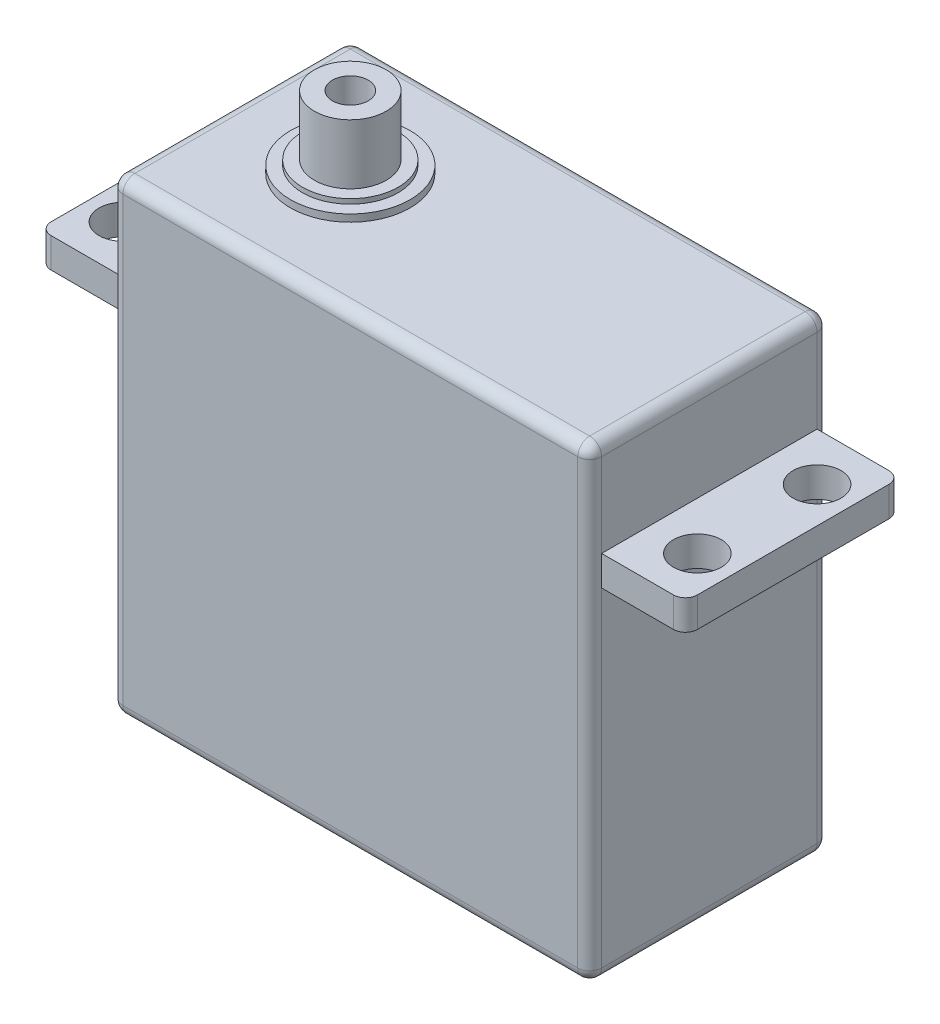
from build123d import *

# Parameters (mm, degrees)
SKETCH_2_W          = 40
SKETCH_2_H          = 39
EXTRUDE_1_DEPTH     = 20
FILLET_1_R          = 1
SKETCH_4_R          = 3
EXTRUDE_2_DEPTH     = 6
SKETCH_5_W          = 18
SKETCH_5_H          = 2.5
EXTRUDE_3_DEPTH     = 7
SKETCH_7_W          = 18
SKETCH_7_H          = 2.5
EXTRUDE_4_DEPTH     = 7
SKETCH_8_R          = 2
CUT_EXTRUDE_1_DEPTH = 7
FILLET_2_R          = 1
SKETCH_12_R         = 1.5
CUT_EXTRUDE_2_DEPTH = 7
SKETCH_13_R         = 4
EXTRUDE_5_DEPTH     = 1
SKETCH_14_R         = 5
EXTRUDE_6_DEPTH     = 0.6
CUT_EXTRUDE_3_REACH = 66.23
SKETCH_15_R         = 1.5


with BuildPart() as part:
    # 草图2 → 凸台-拉伸1 (new body)
    with BuildSketch(Plane.XY):
        with Locations((-19.102827215, 35.538568444)):
            Rectangle(SKETCH_2_W, SKETCH_2_H)
    extrude(amount=EXTRUDE_1_DEPTH)

    # 圆角1
    fillet_1_edges = [part.edges().sort_by_distance(p)[0] for p in [
        (0.897172785, 55.038568444, 10),
        (-19.102827215, 55.038568444, 0),
        (-39.102827215, 55.038568444, 10),
        (-39.102827215, 35.538568444, 0),
        (-39.102827215, 16.038568444, 10),
        (-19.102827215, 16.038568444, 0),
        (0.897172785, 35.538568444, 0),
        (0.897172785, 16.038568444, 10),
        (-19.102827215, 16.038568444, 20),
        (0.897172785, 35.538568444, 20),
        (-19.102827215, 55.038568444, 20),
        (-39.102827215, 35.538568444, 20),
    ]]
    fillet(fillet_1_edges, radius=FILLET_1_R)

    # 草图5 → 凸台-拉伸3 (add)
    with BuildSketch(Plane(origin=(0.897172785, 0, 0), x_dir=(0, 0, -1), z_dir=(1, 0, 0))):
        with Locations((-10, 45.788568444)):
            Rectangle(SKETCH_5_W, SKETCH_5_H)
    extrude(amount=EXTRUDE_3_DEPTH)

    # 草图7 → 凸台-拉伸4 (add)
    with BuildSketch(Plane.ZY.offset(39.102827215)):
        with Locations((10, 45.788568444)):
            Rectangle(SKETCH_7_W, SKETCH_7_H)
    extrude(amount=EXTRUDE_4_DEPTH)

    # 草图8 → 切除-拉伸1 (cut)
    with BuildSketch(Plane(origin=(0, 47.038568444, 0), x_dir=(1, 0, 0), z_dir=(0, 1, 0))):
        with Locations((-43.102827215, -5)):
            Circle(SKETCH_8_R)
        with Locations((-43.102827215, -15)):
            Circle(SKETCH_8_R)
        with Locations((4.897172785, -5)):
            Circle(SKETCH_8_R)
        with Locations((4.897172785, -15)):
            Circle(SKETCH_8_R)
    extrude(amount=-CUT_EXTRUDE_1_DEPTH, mode=Mode.SUBTRACT)

    # 圆角2
    fillet_2_edges = [part.edges().sort_by_distance(p)[0] for p in [
        (7.897172785, 45.788568444, 19),
        (7.897172785, 45.788568444, 1),
        (-46.102827215, 45.788568444, 19),
        (-46.102827215, 45.788568444, 1),
    ]]
    fillet(fillet_2_edges, radius=FILLET_2_R)


with BuildPart() as body_2:
    # 草图4 → 凸台-拉伸2 (new body)
    with BuildSketch(Plane(origin=(0, 55.038568444, 0), x_dir=(1, 0, 0), z_dir=(0, 1, 0))):
        with Locations((-29.102827215, -10)):
            Circle(SKETCH_4_R)
    extrude(amount=EXTRUDE_2_DEPTH)


with BuildPart() as cut_extrude_2_tool:
    # 草图12 → 切除-拉伸2 (new body)
    with BuildSketch(Plane(origin=(0, 61.038568444, 0), x_dir=(1, 0, 0), z_dir=(0, 1, 0))):
        with Locations((-29.102827215, -10)):
            Circle(SKETCH_12_R)
    extrude(amount=-CUT_EXTRUDE_2_DEPTH)


with BuildPart() as part_1:
    add(part.part)

    # 切除-拉伸2: cut by cut_extrude_2_tool
    add(cut_extrude_2_tool.part, mode=Mode.SUBTRACT)



with BuildPart() as body_2_1:
    add(body_2.part)

    # 切除-拉伸2: cut by cut_extrude_2_tool
    add(cut_extrude_2_tool.part, mode=Mode.SUBTRACT)


with BuildPart() as part_2:
    add(part_1.part)

    add(body_2_1.part)  # 凸台-拉伸5 merges body 2
    # 草图13 → 凸台-拉伸5 (add)
    with BuildSketch(Plane(origin=(0, 55.038568444, 0), x_dir=(1, 0, 0), z_dir=(0, 1, 0))):
        with Locations((-29.102827215, -10)):
            Circle(SKETCH_13_R)
    extrude(amount=EXTRUDE_5_DEPTH)

    # 草图14 → 凸台-拉伸6 (add)
    with BuildSketch(Plane(origin=(0, 55.038568444, 0), x_dir=(1, 0, 0), z_dir=(0, 1, 0))):
        with Locations((-29.102827215, -10)):
            Circle(SKETCH_14_R)
    extrude(amount=EXTRUDE_6_DEPTH)

    # 草图15 → 切除-拉伸3 (cut, up to next)
    with BuildSketch(Plane(origin=(0, 56.038568444, 0), x_dir=(1, 0, 0), z_dir=(0, 1, 0)), mode=Mode.PRIVATE) as cut_extrude_3_sk1:
        with Locations((-29.102827215, -10)):
            Circle(SKETCH_15_R)
    cut_extrude_3_tool1 = extrude(cut_extrude_3_sk1.sketch, amount=-CUT_EXTRUDE_3_REACH, mode=Mode.PRIVATE) & part_2.part
    add(cut_extrude_3_tool1.solids().sort_by_distance((-29.102827, 56.038568, 10))[0], mode=Mode.SUBTRACT)


solid = part_2.part
